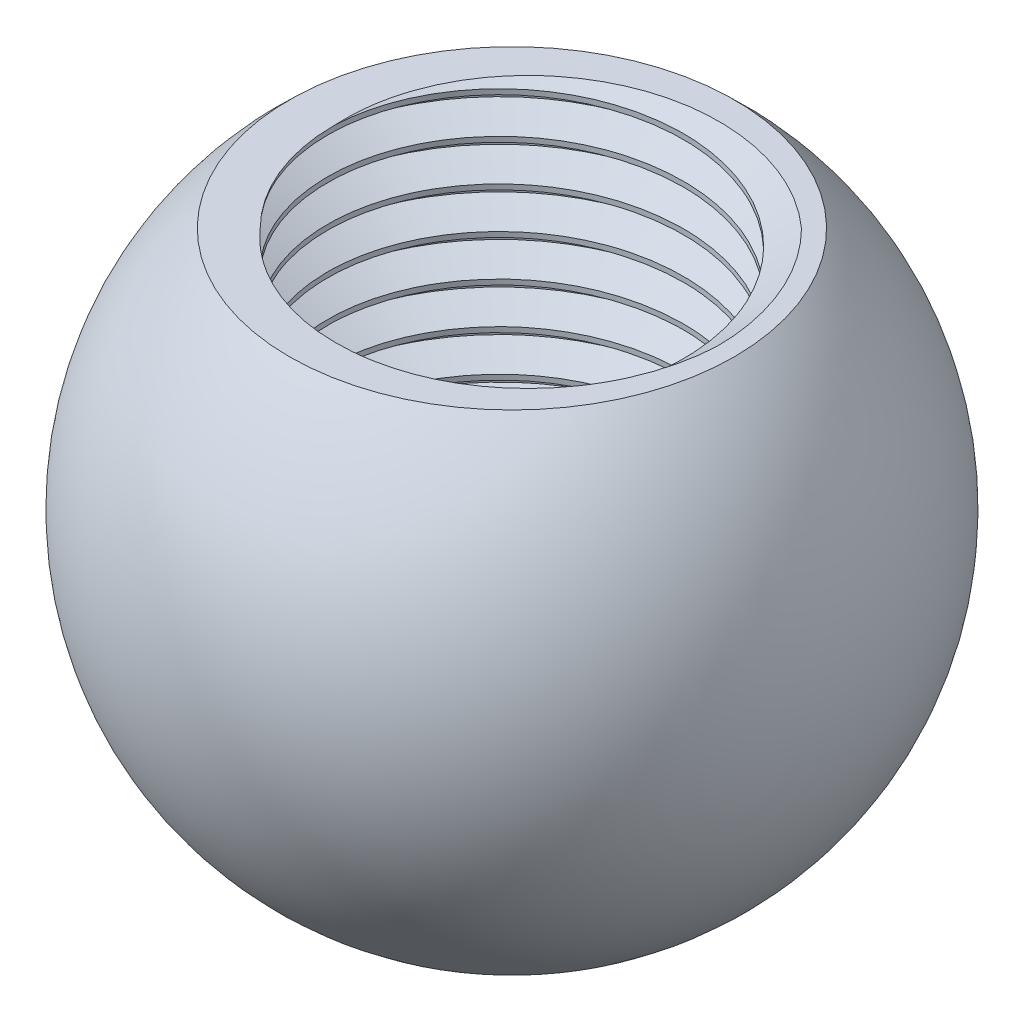
from build123d import *

# Parameters (mm, degrees)
CROQUIS1_R                                     = 6.75
SALIENTE_EXTRUIR1_DEPTH                        = 14
PERFORADOR_PARA_ROSCAR_PARA_MACHO_DE_ROS_D     = 10.8
PERFORADOR_PARA_ROSCAR_PARA_MACHO_DE_ROS_DEPTH = 9
PERFORADOR_PARA_ROSCAR_PARA_MACHO_DE_ROS_TIP   = 3.244647343
CORTAR_BARRER1_PITCH                           = 1.25


with BuildPart() as part:
    # Croquis1 → Saliente-Extruir1 (new body)
    with BuildSketch(Plane(origin=(0, 0, 0), x_dir=(1, 0, 0), z_dir=(0, 1, 0))):
        with Locations(Location((0, 0, 0), (0, 0, 270))):
            Circle(CROQUIS1_R)
    extrude(amount=SALIENTE_EXTRUIR1_DEPTH)

    # Perforador para roscar para macho de roscar para M12x1.251
    with Locations(Plane.ZX.offset(14)):
        with Locations((0, 0)):
            Hole(PERFORADOR_PARA_ROSCAR_PARA_MACHO_DE_ROS_D / 2, depth=PERFORADOR_PARA_ROSCAR_PARA_MACHO_DE_ROS_DEPTH)
            with Locations((0, 0, -(PERFORADOR_PARA_ROSCAR_PARA_MACHO_DE_ROS_DEPTH + PERFORADOR_PARA_ROSCAR_PARA_MACHO_DE_ROS_TIP / 2))):  # 118° drill point
                Cone(0, PERFORADOR_PARA_ROSCAR_PARA_MACHO_DE_ROS_D / 2, PERFORADOR_PARA_ROSCAR_PARA_MACHO_DE_ROS_TIP, mode=Mode.SUBTRACT)

    # Cortar-Barrer1: arcs per turn and ends read off the stored shape
    # Cortar-Barrer1: the profile of Croquis4 profile screwed along a right-hand helix through 9 turns, 8 arcs to a turn; built about Z, then put on its axis
    cortar_barrer1_z = Axis((0, 0, 0), (0, 0, 1))
    cortar_barrer1_corners = [(6.211915285, 0, -1.874990491), (5.3997, 0, -2.343923205), (5.3997, 0, -1.249826795), (6.211915285, 0, -1.718759509), (6.257015285, 0, -1.796875)]
    with BuildLine(mode=Mode.PRIVATE) as cortar_barrer1_profile:
        Line(cortar_barrer1_corners[0], cortar_barrer1_corners[1])
        Line(cortar_barrer1_corners[1], cortar_barrer1_corners[2])
        Line(cortar_barrer1_corners[2], cortar_barrer1_corners[3])
        ThreePointArc((6.211915285, 0, -1.718759509), (6.244930777, 0, -1.751775), (6.257015285, 0, -1.796875))
        ThreePointArc((6.257015285, 0, -1.796875), (6.244930777, 0, -1.841975), (6.211915285, 0, -1.874990491))
    cortar_barrer1_cap = Face(cortar_barrer1_profile.wire())
    cortar_barrer1_arcs = [((6.211915285, 0, -1.718759509), (6.257015285, 0, -1.744798006), (6.257015285, 0, -1.796875), (1, 0.8660254037844389, 1)), ((6.257015285, 0, -1.796875), (6.257015285, 0, -1.848951994), (6.211915285, 0, -1.874990491), (1, 0.8660254037844389, 1))]  # start, shoulder, end, weights
    cortar_barrer1_turn_angles = [0, 22.5, 45, 67.5, 90, 112.5, 135, 157.5, 180, 202.5, 225, 247.5, 270, 292.5, 315, 337.5, 360]
    cortar_barrer1_turn_weights = [1, 0.9238795325112867, 1, 0.9238795325112867, 1, 0.9238795325112867, 1, 0.9238795325112867, 1, 0.9238795325112867, 1, 0.9238795325112867, 1, 0.9238795325112867, 1, 0.9238795325112867, 1]
    cortar_barrer1_turn_rails = [Edge.make_bspline([Vector(p[0], p[1], 0).rotate(cortar_barrer1_z, cortar_barrer1_turn_angles[k]) / cortar_barrer1_turn_weights[k] + Vector(0, 0, p[2] + CORTAR_BARRER1_PITCH * cortar_barrer1_turn_angles[k] / 360) for k in range(17)], [0, 0, 0, 1, 1, 2, 2, 3, 3, 4, 4, 5, 5, 6, 6, 7, 7, 8, 8, 8], 2, cortar_barrer1_turn_weights) for p in cortar_barrer1_corners]
    cortar_barrer1_turn_sides = [*[Face.make_surface_from_curves(cortar_barrer1_turn_rails[p[0]], cortar_barrer1_turn_rails[p[1]]) for p in [(0, 1), (1, 2), (2, 3)]], *[Face.make_bezier_surface([[Vector(p[j][0], p[j][1], 0).rotate(cortar_barrer1_z, cortar_barrer1_turn_angles[2 * i + k]) / cortar_barrer1_turn_weights[2 * i + k] + Vector(0, 0, p[j][2] + CORTAR_BARRER1_PITCH * cortar_barrer1_turn_angles[2 * i + k] / 360) for k in range(3)] for j in range(3)], [[p[3][j] * cortar_barrer1_turn_weights[2 * i + k] for k in range(3)] for j in range(3)]) for p in cortar_barrer1_arcs for i in range(8)]]
    cortar_barrer1 = Plane(origin=(0, 14, 0), x_dir=(-1, 0, 0), z_dir=(0, -1, 0)) * Solid(Shell([*[p.moved(Location((0, 0, CORTAR_BARRER1_PITCH * i))) for i in range(9) for p in cortar_barrer1_turn_sides], cortar_barrer1_cap, cortar_barrer1_cap.rotate(cortar_barrer1_z, 3240).moved(Location((0, 0, CORTAR_BARRER1_PITCH * 3240 / 360)))]))
    add(cortar_barrer1, mode=Mode.SUBTRACT)

    # Croquis6 → Revolución1 (revolve)
    with BuildSketch(Plane.XY, mode=Mode.PRIVATE) as revoluci_n1_sk:
        with BuildLine():
            Line((6.75, 14), (6.211915277, 14))
            Line((6.211915277, 14), (6.211915277, 1))
            Line((6.211915277, 1), (0, 1))
            Line((0, 1), (0, -3.378177282))
            ThreePointArc((0, -3.378177282), (9.321528116, 3.001171728), (6.75, 14))
        make_face()
    revolve(revoluci_n1_sk.sketch.rotate(Axis((0, 1, 0), (0, -1, 0)), 90), axis=Axis((0, 1, 0), (0, -1, 0)))


solid = part.part
